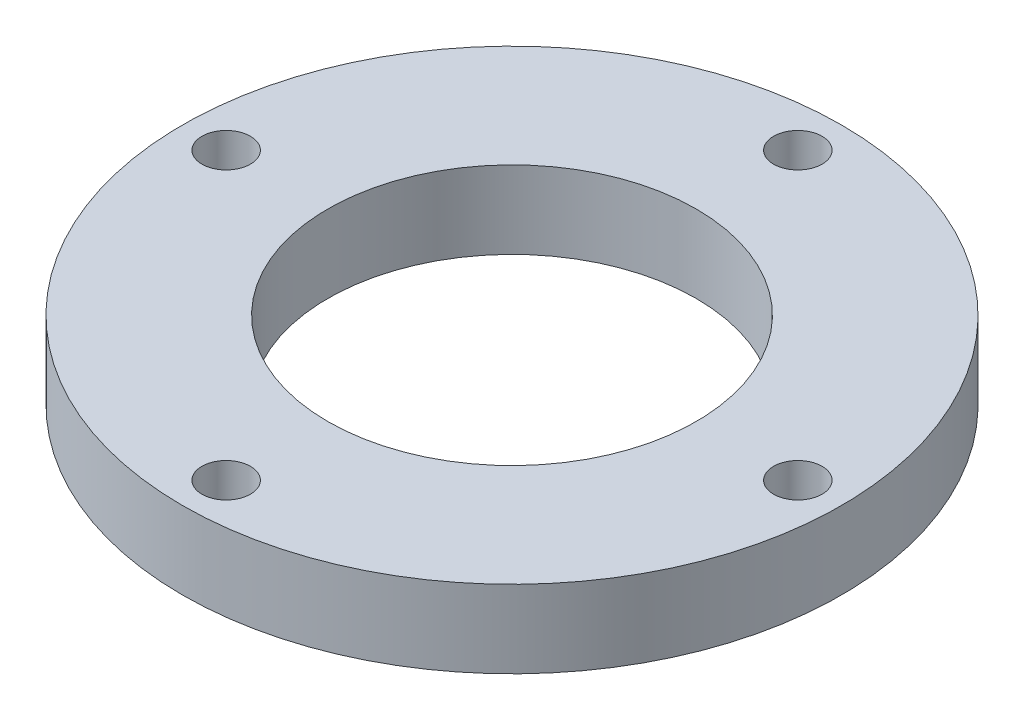
from build123d import *

# Parameters (mm, degrees)
SKETCH_1_R          = 34
SKETCH_1_R_2        = 19
EXTRUDE_1_DEPTH     = 8
SKETCH_2_R          = 2.5
CUT_EXTRUDE_1_DEPTH = 49.744230428


with BuildPart() as part:
    # Эскиз1 → Вытянуть1 (new body)
    with BuildSketch(Plane(origin=(0, 0, 0), x_dir=(1, 0, 0), z_dir=(0, 1, 0))):
        Circle(SKETCH_1_R)
        Circle(SKETCH_1_R_2, mode=Mode.SUBTRACT)
    extrude(amount=EXTRUDE_1_DEPTH)

    # Эскиз2 → Вырез-Вытянуть1 (cut, through all)
    with BuildSketch(Plane(origin=(0, 8, 0), x_dir=(1, 0, 0), z_dir=(0, 1, 0))):
        with Locations((0, 29.48960133)):
            Circle(SKETCH_2_R)
        with Locations((29.48960133, 0)):
            Circle(SKETCH_2_R)
        with Locations((0, -29.48960133)):
            Circle(SKETCH_2_R)
        with Locations((-29.48960133, 0)):
            Circle(SKETCH_2_R)
    extrude(amount=-CUT_EXTRUDE_1_DEPTH, mode=Mode.SUBTRACT)


solid = part.part
